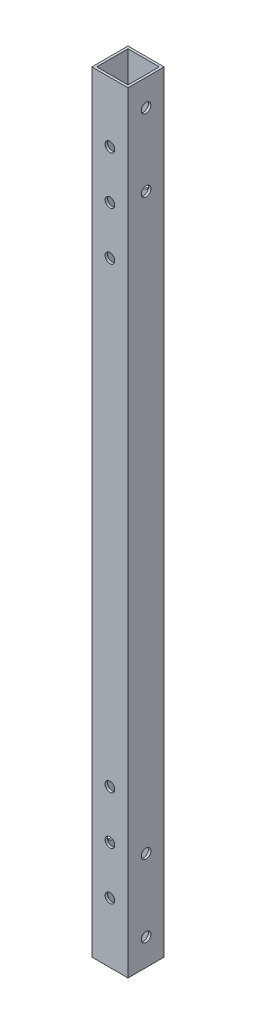
from build123d import *

# Parameters (mm, degrees)
SKETCH_1_W          = 15
SKETCH_1_H          = 15
SKETCH_1_W_2        = 13
SKETCH_1_H_2        = 13
EXTRUDE_1_DEPTH     = 320
SKETCH_3_R          = 2
CUT_EXTRUDE_2_DEPTH = 321.43915179
SKETCH_4_R          = 2
CUT_EXTRUDE_3_DEPTH = 321.43915179


with BuildPart() as part:
    # 草图1 → 凸台-拉伸1 (new body)
    with BuildSketch(Plane(origin=(0, 0, 0), x_dir=(1, 0, 0), z_dir=(0, 1, 0))):
        Rectangle(SKETCH_1_W, SKETCH_1_H)
        Rectangle(SKETCH_1_W_2, SKETCH_1_H_2, mode=Mode.SUBTRACT)
    extrude(amount=EXTRUDE_1_DEPTH)

    # 草图3 → 切除-拉伸2 (cut, through all)
    with BuildSketch(Plane.XY.offset(7.5)):
        with Locations((0, 295)):
            Circle(SKETCH_3_R)
        with Locations((0, 275)):
            Circle(SKETCH_3_R)
        with Locations((0, 45)):
            Circle(SKETCH_3_R)
        with Locations((0, 25)):
            Circle(SKETCH_3_R)
        with Locations((0, 255)):
            Circle(SKETCH_3_R)
        with Locations((0, 65)):
            Circle(SKETCH_3_R)
    extrude(amount=-CUT_EXTRUDE_2_DEPTH, mode=Mode.SUBTRACT)

    # 草图4 → 切除-拉伸3 (cut, through all)
    with BuildSketch(Plane.ZY.offset(7.5)):
        with Locations((0, 11)):
            Circle(SKETCH_4_R)
        with Locations((0, 41)):
            Circle(SKETCH_4_R)
        with Locations((0, 279)):
            Circle(SKETCH_4_R)
        with Locations((0, 309)):
            Circle(SKETCH_4_R)
    extrude(amount=-CUT_EXTRUDE_3_DEPTH, mode=Mode.SUBTRACT)


solid = part.part
